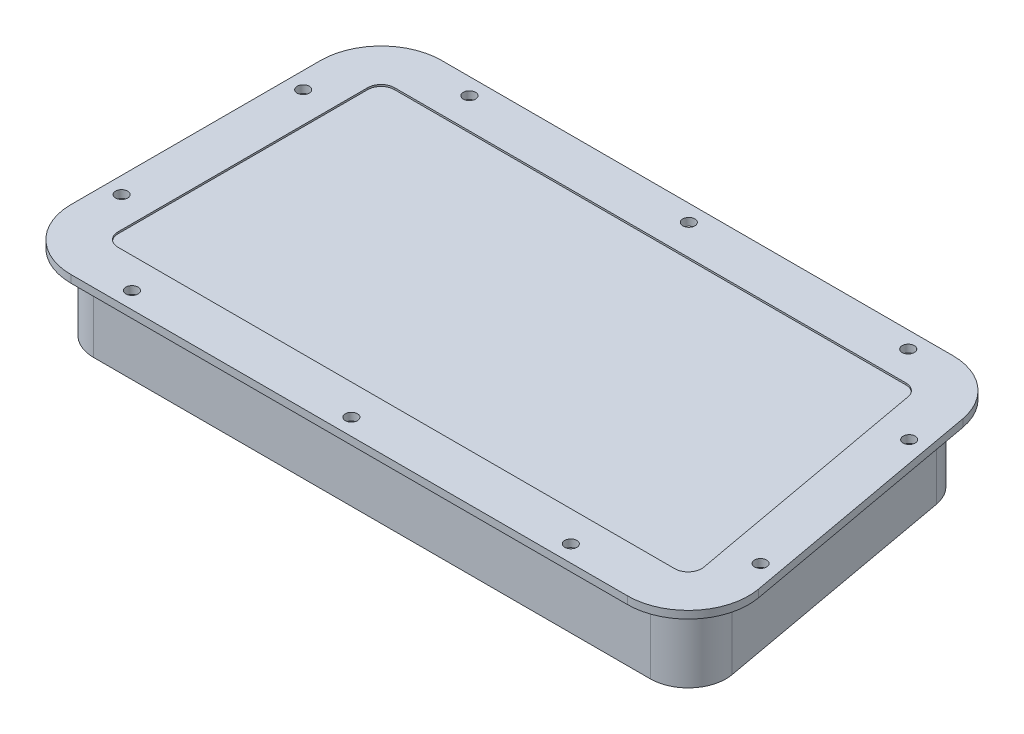
from build123d import *

# Parameters (mm, degrees)
SURFACE_EXTRUDE1_1_BACK  = 100
SURFACE_EXTRUDE1_1_DEPTH = 100
THICKEN1_T1              = 30
SURFACE_EXTRUDE2_2_DEPTH = 10
THICKEN2_T1              = 30
THICKEN2_T2              = 30
SKETCH3_R                = 8
CUT_EXTRUDE1_DEPTH       = 185.166
THICKEN3_START           = -100
THICKEN3_DEPTH           = 2.286
THICKEN4_START           = 7.714
THICKEN4_DEPTH           = 2.286
THICKEN8_START           = -97.714
THICKEN8_DEPTH           = 105.427999964


# Read off the part's stored shape, not the designer's step: Thicken3, Thicken4, Thicken8
with BuildPart() as body_1:
    # Surface-Extrude1: a surface, the sketch's curves swept straight by 100 mm
    with BuildLine(Plane(origin=(0, 0, 0), x_dir=(1, 0, 0), z_dir=(0, 1, 0)).offset(-SURFACE_EXTRUDE1_1_BACK), mode=Mode.PRIVATE) as surface_extrude1_1_path:
        Line((-486.756814761, 147.686739346), (-486.756814761, -182.313260654))
        ThreePointArc((-486.756814761, -182.313260654), (-472.112153821, -217.668599714), (-436.756814761, -232.313260654))
        Line((-436.756814761, -232.313260654), (299.049689734, -232.313260654))
        ThreePointArc((299.049689734, -232.313260654), (337.43727624, -214.350632617), (348.243185239, -173.368988744))
        Line((348.243185239, -173.368988744), (288.243185239, 156.631011256))
        ThreePointArc((288.243185239, 156.631011256), (271.087061696, 186.074325852), (239.049689734, 197.686739346))
        Line((239.049689734, 197.686739346), (-436.756814761, 197.686739346))
        ThreePointArc((-436.756814761, 197.686739346), (-472.112153821, 183.042078405), (-486.756814761, 147.686739346))
    surface_extrude1_1 = Shell.extrude(surface_extrude1_1_path.wire(), (0 * SURFACE_EXTRUDE1_1_DEPTH, 1 * SURFACE_EXTRUDE1_1_DEPTH, 0 * SURFACE_EXTRUDE1_1_DEPTH))
    add(Solid.thicken(surface_extrude1_1, THICKEN1_T1))

    # Surface-Extrude2: a surface, the sketch's curves swept straight by 10 mm
    with BuildLine(Plane(origin=(0, 0, 0), x_dir=(1, 0, 0), z_dir=(0, 1, 0)), mode=Mode.PRIVATE) as surface_extrude2_2_path:
        Line((-486.756814761, 147.686739346), (-486.756814761, -182.313260654))
        ThreePointArc((-486.756814761, -182.313260654), (-472.112153821, -217.668599714), (-436.756814761, -232.313260654))
        Line((-436.756814761, -232.313260654), (299.049689734, -232.313260654))
        ThreePointArc((299.049689734, -232.313260654), (337.43727624, -214.350632617), (348.243185239, -173.368988744))
        Line((348.243185239, -173.368988744), (288.243185239, 156.631011256))
        ThreePointArc((288.243185239, 156.631011256), (271.087061696, 186.074325852), (239.049689734, 197.686739346))
        Line((239.049689734, 197.686739346), (-436.756814761, 197.686739346))
        ThreePointArc((-436.756814761, 197.686739346), (-472.112153821, 183.042078405), (-486.756814761, 147.686739346))
    surface_extrude2_2 = Shell.extrude(surface_extrude2_2_path.wire(), (0 * SURFACE_EXTRUDE2_2_DEPTH, 1 * SURFACE_EXTRUDE2_2_DEPTH, 0 * SURFACE_EXTRUDE2_2_DEPTH))
    add(Solid.thicken(surface_extrude2_2, THICKEN2_T1))
    add(Solid.thicken(surface_extrude2_2, -THICKEN2_T2))

    # Sketch3 → Cut-Extrude1 (cut)
    with BuildSketch(Plane(origin=(0, 10, 0), x_dir=(1, 0, 0), z_dir=(0, 1, 0))):
        with Locations(Location((-378.065726857, 205.686739346, 0), (0, 0, 270))):
            Circle(SKETCH3_R)
        with Locations(Location((-88.065726857, 205.686739346, 0), (0, 0, 270))):
            Circle(SKETCH3_R)
        with Locations(Location((201.934273143, 205.686739346, 0), (0, 0, 270))):
            Circle(SKETCH3_R)
        with Locations(Location((-494.756814761, 102.686739346, 0), (0, 0, 270))):
            Circle(SKETCH3_R)
        with Locations(Location((-494.756814761, -137.343260654, 0), (0, 0, 270))):
            Circle(SKETCH3_R)
        with Locations(Location((-378.049461671, -240.313260654, 0), (0, 0, 270))):
            Circle(SKETCH3_R)
        with Locations(Location((-88.049461789, -240.313260654, 0), (0, 0, 270))):
            Circle(SKETCH3_R)
        with Locations(Location((201.950538093, -240.313260654, 0), (0, 0, 270))):
            Circle(SKETCH3_R)
        with Locations(Location((306.176936413, 102.716739346, 0), (0, 0, 270))):
            Circle(SKETCH3_R)
        with Locations(Location((349.818754595, -137.313260654, 0), (0, 0, 270))):
            Circle(SKETCH3_R)
    extrude(amount=-CUT_EXTRUDE1_DEPTH, mode=Mode.SUBTRACT)

    # Thicken3 outline → Thicken3 (add)
    with BuildSketch(Plane(origin=(0, 0, 0), x_dir=(1, 0, 0), z_dir=(0, 1, 0)).offset(THICKEN3_START)):
        with BuildLine():
            ThreePointArc((299.049689734, -202.313260654), (314.404724336, -195.128209439), (318.727087936, -178.73555189))
            Line((318.727087936, -178.73555189), (258.727087936, 151.26444811))
            ThreePointArc((258.727087936, 151.26444811), (251.864638519, 163.041773948), (239.049689734, 167.686739346))
            Line((239.049689734, 167.686739346), (-436.756814761, 167.686739346))
            ThreePointArc((-436.756814761, 167.686739346), (-450.898950384, 161.828874969), (-456.756814761, 147.686739346))
            Line((-456.756814761, 147.686739346), (-456.756814761, -182.313260654))
            ThreePointArc((-456.756814761, -182.313260654), (-450.898950385, -196.455396278), (-436.756814761, -202.313260654))
            Line((-436.756814761, -202.313260654), (299.049689734, -202.313260654))
        make_face()
        with BuildLine():
            ThreePointArc((239.049689734, 162.846739374), (248.763420931, 159.325855596), (253.965157598, 150.398642594))
            Line((253.965157598, 150.398642594), (313.965157598, -179.601357406))
            ThreePointArc((313.965157598, -179.601357406), (310.688805984, -192.026991851), (299.049689734, -197.473260682))
            Line((299.049689734, -197.473260682), (-436.756814761, -197.473260682))
            ThreePointArc((-436.756814761, -197.473260682), (-447.476553584, -193.032999477), (-451.916814789, -182.313260654))
            Line((-451.916814789, -182.313260654), (-451.916814789, 147.686739346))
            ThreePointArc((-451.916814789, 147.686739346), (-447.476553583, 158.406478169), (-436.756814761, 162.846739374))
            Line((-436.756814761, 162.846739374), (239.049689734, 162.846739374))
        make_face(mode=Mode.SUBTRACT)
    extrude(amount=THICKEN3_DEPTH)

    # Thicken4 outline → Thicken4 (add)
    with BuildSketch(Plane(origin=(0, 0, 0), x_dir=(1, 0, 0), z_dir=(0, 1, 0)).offset(THICKEN4_START)):
        with BuildLine():
            ThreePointArc((299.049689734, -202.313260654), (314.404724336, -195.128209439), (318.727087936, -178.73555189))
            Line((318.727087936, -178.73555189), (258.727087936, 151.26444811))
            ThreePointArc((258.727087936, 151.26444811), (251.864638519, 163.041773948), (239.049689734, 167.686739346))
            Line((239.049689734, 167.686739346), (-436.756814761, 167.686739346))
            ThreePointArc((-436.756814761, 167.686739346), (-450.898950384, 161.828874969), (-456.756814761, 147.686739346))
            Line((-456.756814761, 147.686739346), (-456.756814761, -182.313260654))
            ThreePointArc((-456.756814761, -182.313260654), (-450.898950385, -196.455396278), (-436.756814761, -202.313260654))
            Line((-436.756814761, -202.313260654), (299.049689734, -202.313260654))
        make_face()
        with BuildLine():
            Line((256.477961321, 150.855515998), (316.477961321, -179.144484002))
            ThreePointArc((316.477961321, -179.144484002), (312.649643881, -193.663460793), (299.049689734, -200.027260654))
            Line((299.049689734, -200.027260654), (-436.756814761, -200.027260654))
            ThreePointArc((-436.756814761, -200.027260654), (-449.282504283, -194.838950176), (-454.470814761, -182.313260654))
            Line((-454.470814761, -182.313260654), (-454.470814761, 147.686739346))
            ThreePointArc((-454.470814761, 147.686739346), (-449.282504283, 160.212428868), (-436.756814761, 165.400739346))
            Line((-436.756814761, 165.400739346), (239.049689734, 165.400739346))
            ThreePointArc((239.049689734, 165.400739346), (250.399889873, 161.286693493), (256.477961321, 150.855515998))
        make_face(mode=Mode.SUBTRACT)
    extrude(amount=THICKEN4_DEPTH)


with BuildPart() as body_2:
    # Thicken8 outline → Thicken8 (new body)
    with BuildSketch(Plane(origin=(0, 0, 0), x_dir=(1, 0, 0), z_dir=(0, 1, 0)).offset(THICKEN8_START)):
        with BuildLine():
            ThreePointArc((-436.756814761, 167.686739346), (-450.898950384, 161.828874969), (-456.756814761, 147.686739346))
            Line((-456.756814761, 147.686739346), (-456.756814761, -182.313260654))
            ThreePointArc((-456.756814761, -182.313260654), (-450.898950385, -196.455396278), (-436.756814761, -202.313260654))
            Line((-436.756814761, -202.313260654), (299.049689734, -202.313260654))
            ThreePointArc((299.049689734, -202.313260654), (314.404724336, -195.128209439), (318.727087936, -178.73555189))
            Line((318.727087936, -178.73555189), (258.727087936, 151.26444811))
            ThreePointArc((258.727087936, 151.26444811), (251.864638519, 163.041773948), (239.049689734, 167.686739346))
            Line((239.049689734, 167.686739346), (-436.756814761, 167.686739346))
        make_face()
    extrude(amount=THICKEN8_DEPTH)


solid = Compound([body_1.part, body_2.part])
